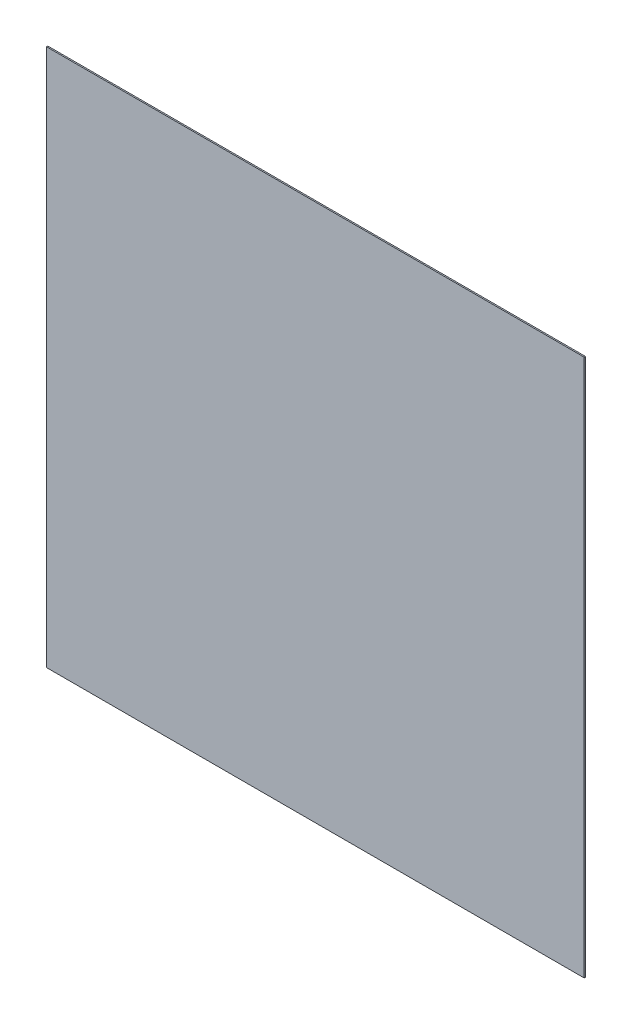
from build123d import *

# Parameters (mm, degrees)
SKETCH1_W           = 625
SKETCH1_H           = 625
BOSS_EXTRUDE1_DEPTH = 1.5
SKETCH2_R           = 5
BOSS_EXTRUDE2_DEPTH = 1.5


with BuildPart() as part:
    # Sketch1 → Boss-Extrude1 (new body)
    with BuildSketch(Plane.XY):
        Rectangle(SKETCH1_W, SKETCH1_H)
    extrude(amount=BOSS_EXTRUDE1_DEPTH)

    # Sketch2 → Boss-Extrude2 (add)
    with BuildSketch(Plane(origin=(0, 0, 0), x_dir=(-1, 0, 0), z_dir=(0, 0, -1))):
        with Locations((0, 292.5)):
            Circle(SKETCH2_R)
        with Locations((-292.5, 0)):
            Circle(SKETCH2_R)
        with Locations((0, -292.5)):
            Circle(SKETCH2_R)
        with Locations((292.5, 0)):
            Circle(SKETCH2_R)
    extrude(amount=BOSS_EXTRUDE2_DEPTH)


solid = part.part
